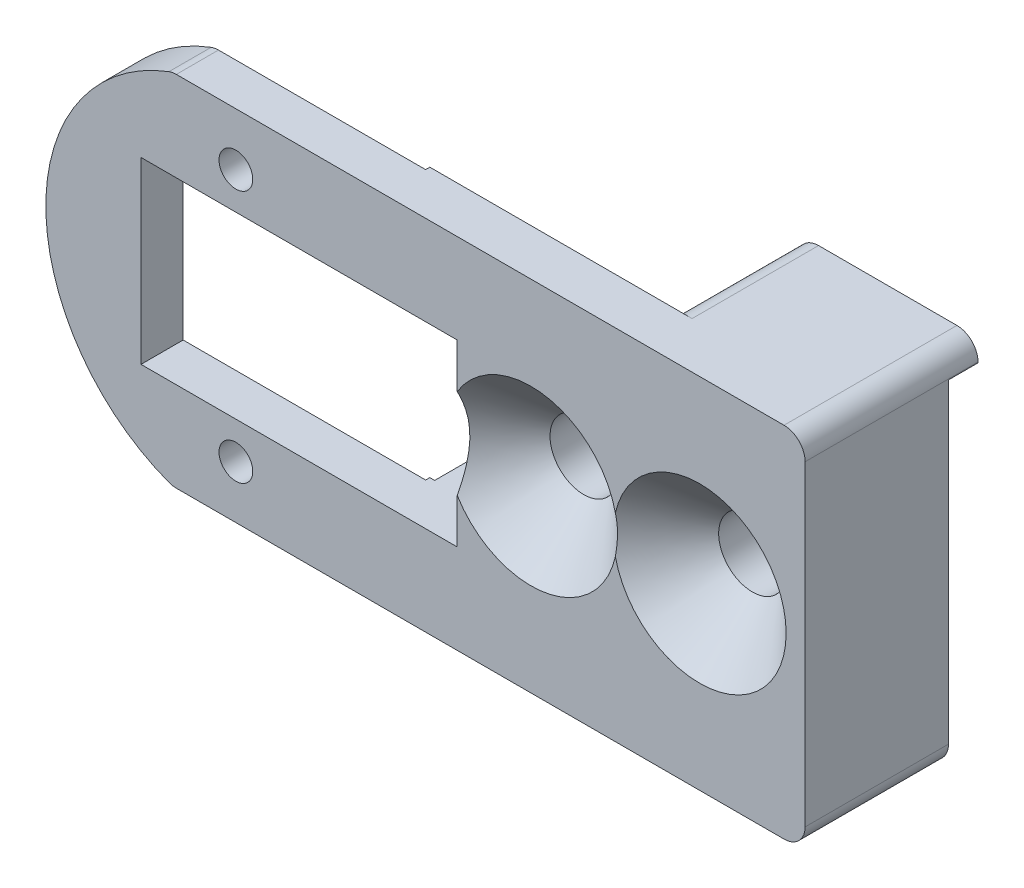
from build123d import *

# Parameters (mm, degrees)
SKETCH4_R               = 1.6
BOSS_EXTRUDE1_DEPTH     = 4.8
SKETCH5_R               = 1.6
SKETCH5_R_2             = 0.8
BOSS_EXTRUDE3_DEPTH     = 2
BOSS_EXTRUDE4_DEPTH     = 1.4
CUT_EXTRUDE1_DEPTH      = 1.4
CUT_EXTRUDE1_DEPTH_BACK = 4.6
CHAMFER1_SIZE           = 2.5
FILLET1_R               = 1
CUT_EXTRUDE2_DEPTH      = 10


with BuildPart() as part:
    # Sketch4 → Boss-Extrude1 (new body)
    with BuildSketch(Plane.XY):
        Polygon((183.415148292, 173.842793615), (168.415148292, 173.842793615), (168.415148292, 190.842793615), (183.415148292, 190.842793615), (188.415148292, 190.842793615), (188.415148292, 173.842793615), align=None)
        with Locations((175.415148292, 182.342793615)):
            Circle(SKETCH4_R, mode=Mode.SUBTRACT)
        with Locations((183.415148292, 182.342793615)):
            Circle(SKETCH4_R, mode=Mode.SUBTRACT)
    extrude(amount=BOSS_EXTRUDE1_DEPTH)

    # Sketch5 → Boss-Extrude3 (add)
    with BuildSketch(Plane.XY.offset(4.8)):
        with BuildLine():
            ThreePointArc((158.415148292, 190.842793615), (152.401270103, 182.342793615), (158.415148292, 173.842793615))
            Line((158.415148292, 173.842793615), (188.415148292, 173.842793615))
            Line((188.415148292, 173.842793615), (188.415148292, 190.842793615))
            Line((188.415148292, 190.842793615), (158.415148292, 190.842793615))
        make_face()
        with Locations((175.415148292, 182.342793615)):
            Circle(SKETCH5_R, mode=Mode.SUBTRACT)
        with Locations((183.415148292, 182.342793615)):
            Circle(SKETCH5_R, mode=Mode.SUBTRACT)
        with Locations((161.415148292, 176.342793615)):
            Circle(SKETCH5_R_2, mode=Mode.SUBTRACT)
        with Locations((161.415148292, 188.342793615)):
            Circle(SKETCH5_R_2, mode=Mode.SUBTRACT)
    extrude(amount=BOSS_EXTRUDE3_DEPTH)

    # Sketch6 → Boss-Extrude4 (add)
    with BuildSketch(Plane(origin=(0, 0, 0), x_dir=(-1, 0, 0), z_dir=(0, 0, -1))):
        Polygon((-183.415148292, 189.608806881), (-168.415148292, 189.02555036), (-168.415148292, 190.842793615), (-183.415148292, 190.842793615), (-188.415148292, 190.842793615), (-188.415148292, 189.803225722), align=None)
    extrude(amount=BOSS_EXTRUDE4_DEPTH)

    # Sketch8 → Cut-Extrude1 (cut, two sides: drawn at the far end of the back side and taken through both)
    with BuildSketch(Plane(origin=(0, 0, 0), x_dir=(-1, 0, 0), z_dir=(0, 0, -1)).offset(-CUT_EXTRUDE1_DEPTH_BACK)):
        Polygon((-180.415148292, 190.842793615), (-168.415148292, 177.842793615), (-168.415148292, 190.842793615), align=None)
    extrude(amount=CUT_EXTRUDE1_DEPTH + CUT_EXTRUDE1_DEPTH_BACK, mode=Mode.SUBTRACT)

    # Chamfer1
    # the kernel refuses this chamfer: 2.5 mm, written as the material it takes off along each edge
    with BuildSketch(Plane(origin=(175.415148292, 182.342793615, 6.8), x_dir=(1, 0, 0), z_dir=(0, -1, 0))) as chamfer1_piece_1:
        Polygon((1.6 + CHAMFER1_SIZE, 0), (1.6, -CHAMFER1_SIZE), (1.6, 0), align=None)
    revolve(axis=Axis((175.415148292, 182.342793615, 6.8), (0, 0, 1)), mode=Mode.SUBTRACT)
    with BuildSketch(Plane(origin=(183.415148292, 182.342793615, 6.8), x_dir=(1, 0, 0), z_dir=(0, -1, 0))) as chamfer1_piece_2:
        Polygon((1.6 + CHAMFER1_SIZE, 0), (1.6, -CHAMFER1_SIZE), (1.6, 0), align=None)
    revolve(axis=Axis((183.415148292, 182.342793615, 6.8), (0, 0, 1)), mode=Mode.SUBTRACT)

    # Fillet1
    fillet1_edges = [part.edges().sort_by_distance(p)[0] for p in [
        (168.415148292, 173.842793615, 2.4),
        (188.415148292, 190.842793615, 2.7),
        (188.415148292, 173.842793615, 3.4),
        (158.415148292, 190.842793615, 5.8),
        (158.415148292, 173.842793615, 5.8),
        (180.415148292, 190.842793615, 1.6),
    ]]
    fillet(fillet1_edges, radius=FILLET1_R)

    # Sketch9 → Cut-Extrude2 (cut)
    with BuildSketch(Plane.XY.offset(6.8)):
        Polygon((165.915148292, 186.592793615), (171.915148292, 186.592793615), (171.915148292, 178.092793615), (165.915148292, 178.092793615), (156.915148292, 178.092793615), (156.915148292, 186.592793615), align=None)
    extrude(amount=-CUT_EXTRUDE2_DEPTH, mode=Mode.SUBTRACT)


solid = part.part
